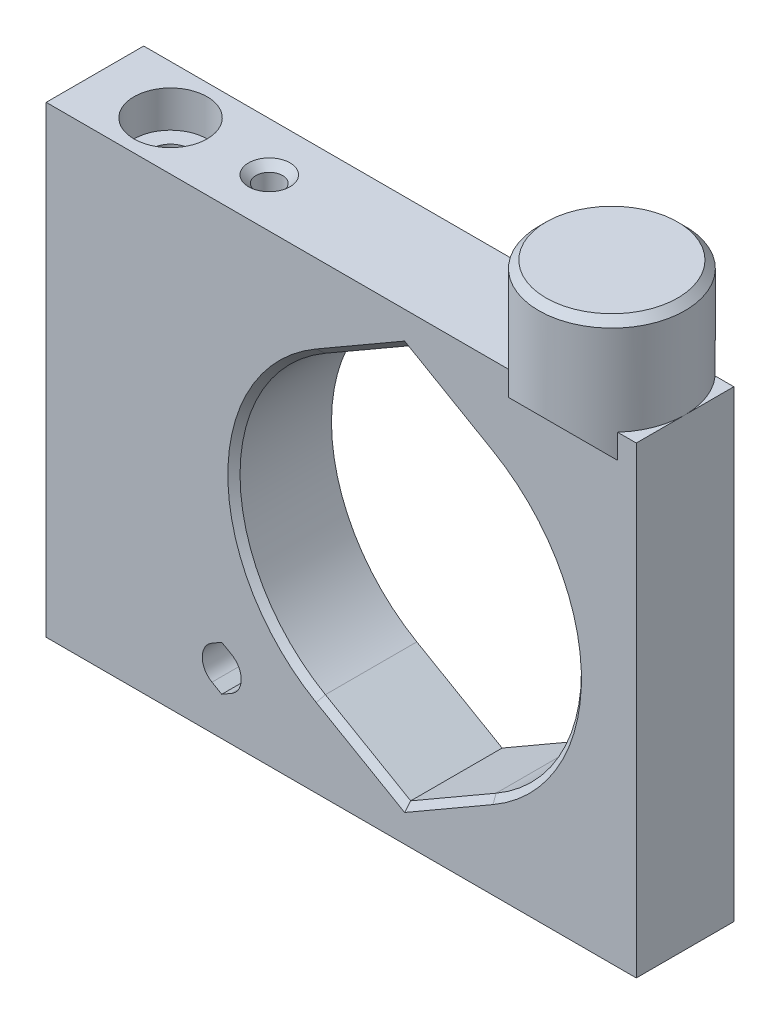
from build123d import *

# Parameters (mm, degrees)
SKETCH1_W           = 48.4
SKETCH1_H           = 38
BOSS_EXTRUDE1_DEPTH = 8
SKETCH2_R           = 3
CUT_EXTRUDE1_DEPTH  = 3
SKETCH3_R           = 1.6
CUT_EXTRUDE2_DEPTH  = 32
CUT_EXTRUDE3_DEPTH  = 3
CUT_EXTRUDE4_DEPTH  = 3
SKETCH6_R           = 1.1
CUT_EXTRUDE5_DEPTH  = 5
CHAMFER1_SIZE       = 0.6
CHAMFER2_SIZE       = 0.5
CHAMFER3_SIZE       = 1.6
SKETCH8_R           = 6
BOSS_EXTRUDE2_DEPTH = 8
CHAMFER4_SIZE       = 2
CHAMFER5_SIZE       = 0.6


with BuildPart() as part:
    # Sketch1 → Boss-Extrude1 (new body)
    with BuildSketch(Plane.XY):
        with Locations((-5.2, 0)):
            Rectangle(SKETCH1_W, SKETCH1_H)
        with BuildLine():
            Line((-7, 12.124355653), (0, 16.165807537))
            Line((0, 16.165807537), (7, 12.124355653))
            ThreePointArc((7, 12.124355653), (14, 0), (7, -12.124355653))
            Line((7, -12.124355653), (0, -16.165807537))
            Line((0, -16.165807537), (-7, -12.124355653))
            ThreePointArc((-7, -12.124355653), (-14, 0), (-7, 12.124355653))
        make_face(mode=Mode.SUBTRACT)
        with BuildLine():
            Line((-15.8, -12.614359354), (-15, -12.152479139))
            Line((-15, -12.152479139), (-14.2, -12.614359354))
            ThreePointArc((-14.2, -12.614359354), (-13.4, -14), (-14.2, -15.385640646))
            Line((-14.2, -15.385640646), (-15, -15.847520861))
            Line((-15, -15.847520861), (-15.8, -15.385640646))
            ThreePointArc((-15.8, -15.385640646), (-16.6, -14), (-15.8, -12.614359354))
        make_face(mode=Mode.SUBTRACT)
    extrude(amount=BOSS_EXTRUDE1_DEPTH)

    # Sketch2 → Cut-Extrude1 (cut)
    with BuildSketch(Plane(origin=(0, 19, 0), x_dir=(1, 0, 0), z_dir=(0, 1, 0))):
        with Locations(Location((-23.2, -4, 0), (0, 0, 270))):
            Circle(SKETCH2_R)
    extrude(amount=-CUT_EXTRUDE1_DEPTH, mode=Mode.SUBTRACT)

    # Sketch3 → Cut-Extrude2 (cut)
    with BuildSketch(Plane(origin=(0, 16, 0), x_dir=(1, 0, 0), z_dir=(0, 1, 0))):
        with Locations(Location((-23.2, -4, 0), (0, 0, 270))):
            Circle(SKETCH3_R)
    extrude(amount=-CUT_EXTRUDE2_DEPTH, mode=Mode.SUBTRACT)

    # Sketch4 → Cut-Extrude3 (cut)
    with BuildSketch(Plane.XZ.offset(19)):
        Polygon((-25.95, 5.58771324), (-25.95, 2.41228676), (-23.2, 0.824573519), (-20.45, 2.41228676), (-20.45, 5.58771324), (-23.2, 7.175426481), align=None)
    extrude(amount=-CUT_EXTRUDE3_DEPTH, mode=Mode.SUBTRACT)

    # Sketch5 → Cut-Extrude4 (cut)
    with BuildSketch(Plane(origin=(0, 0, 0), x_dir=(-1, 0, 0), z_dir=(0, 0, -1))):
        Polygon((12.25, -15.58771324), (12.25, -12.41228676), (15, -10.824573519), (17.75, -12.41228676), (17.75, -15.58771324), (15, -17.175426481), align=None)
    extrude(amount=-CUT_EXTRUDE4_DEPTH, mode=Mode.SUBTRACT)

    # Sketch6 → Cut-Extrude5 (cut)
    with BuildSketch(Plane(origin=(0, 19, 0), x_dir=(1, 0, 0), z_dir=(0, 1, 0))):
        with Locations(Location((-15.1, -4, 0), (0, 0, 270))):
            Circle(SKETCH6_R)
    extrude(amount=-CUT_EXTRUDE5_DEPTH, mode=Mode.SUBTRACT)

    # Chamfer1
    chamfer1_edges = [part.edges().sort_by_distance(p)[0] for p in [
        (-15.1, 19, 2.9),
        (-24.575, -19, 6.38156986),
        (-25.95, -19, 4),
        (-24.575, -19, 1.61843014),
        (-21.825, -19, 1.61843014),
        (-20.45, -19, 4),
        (-21.825, -19, 6.38156986),
    ]]
    chamfer(chamfer1_edges, length=CHAMFER1_SIZE)

    # Chamfer2
    chamfer2_edges = [part.edges().sort_by_distance(p)[0] for p in [
        (-14, 0, 8),
        (-3.5, -14.145081595, 8),
        (3.5, -14.145081595, 8),
        (14, 0, 8),
        (3.5, 14.145081595, 8),
        (-3.5, 14.145081595, 8),
    ]]
    chamfer(chamfer2_edges, length=CHAMFER2_SIZE)

    # Chamfer3
    # the kernel refuses this chamfer: 1.6 mm, written as the material it takes off along each edge
    with BuildSketch(Plane(origin=(-23.2, -16, 4), x_dir=(0, 0, 1), z_dir=(-1, 0, 0))) as chamfer3_piece_1_section:
        Polygon((1.6, CHAMFER3_SIZE), (1.6 + CHAMFER3_SIZE, 0), (1.6, 0), align=None)
    chamfer3_piece_1 = revolve(axis=Axis((-23.2, -16, 4), (0, 1, 0)), mode=Mode.PRIVATE)
    chamfer3_piece_1 = split(chamfer3_piece_1, bisect_by=Plane(origin=(-25.591184435, -15.183394219, 5.794875504), z_dir=(0.5000000000000009, 0, -0.8660254037844382)), keep=Keep.TOP, mode=Mode.PRIVATE)
    chamfer3_piece_1 = split(chamfer3_piece_1, bisect_by=Plane(origin=(-20.808815565, -15.183394219, 5.794875504), z_dir=(-0.4999999999999998, 0, -0.8660254037844388)), keep=Keep.TOP, mode=Mode.PRIVATE)
    chamfer3_piece_1 = split(chamfer3_piece_1, bisect_by=Plane(origin=(-25.95, -15.183394219, 1.653222572), z_dir=(1, 0, 0)), keep=Keep.TOP, mode=Mode.PRIVATE)
    chamfer3_piece_1 = split(chamfer3_piece_1, bisect_by=Plane(origin=(-20.45, -15.183394219, 1.653222572), z_dir=(-1, 0, 0)), keep=Keep.TOP, mode=Mode.PRIVATE)
    chamfer3_piece_1 = split(chamfer3_piece_1, bisect_by=Plane(origin=(-23.558815565, -15.183394219, 1.031735783), z_dir=(0.5000000000000006, 0, 0.8660254037844384)), keep=Keep.TOP, mode=Mode.PRIVATE)
    chamfer3_piece_1 = split(chamfer3_piece_1, bisect_by=Plane(origin=(-22.841184435, -15.183394219, 1.031735783), z_dir=(-0.4999999999999998, 0, 0.8660254037844388)), keep=Keep.TOP, mode=Mode.PRIVATE)
    add(chamfer3_piece_1, mode=Mode.SUBTRACT)

    # Sketch8 → Boss-Extrude2 (add)
    with BuildSketch(Plane(origin=(0, 19, 0), x_dir=(1, 0, 0), z_dir=(0, 1, 0))):
        with Locations(Location((13, -4, 0), (0, 0, 138.189685104))):
            Circle(SKETCH8_R)
    extrude(amount=BOSS_EXTRUDE2_DEPTH)

    # Chamfer4
    # the kernel refuses this chamfer: 2 mm, written as the material it adds along each edge
    with BuildSketch(Plane(origin=(22.615501931, 19, 0), x_dir=(0, -0.9996219169112968, 0.02749587661058639), z_dir=(-1, 0, 0))) as chamfer4_piece_1_section:
        Polygon((CHAMFER4_SIZE * 0.999621916911, -CHAMFER4_SIZE * 0.0274958766106), (-CHAMFER4_SIZE * 0.0274958766106, -CHAMFER4_SIZE * 0.999621916911), (0, 0), align=None)
    chamfer4_piece_1 = extrude(amount=19.231003862, mode=Mode.PRIVATE)
    chamfer4_piece_1 = chamfer4_piece_1 & Plane(origin=(13, 18.289975825, 4), x_dir=(-0.7453559924973536, 0, -0.666666666669547), z_dir=(0, -1, 0)) * Cylinder(6, 47, mode=Mode.PRIVATE)
    add(chamfer4_piece_1)
    with BuildSketch(Plane(origin=(22.615501931, 19, 8), x_dir=(0, -0.9996219169112968, -0.02749587661058651), z_dir=(-1, 0, 0))) as chamfer4_piece_2_section:
        Polygon((CHAMFER4_SIZE * 0.999621916911, CHAMFER4_SIZE * 0.0274958766106), (-CHAMFER4_SIZE * 0.0274958766106, CHAMFER4_SIZE * 0.999621916911), (0, 0), align=None)
    chamfer4_piece_2 = extrude(amount=19.231003862, mode=Mode.PRIVATE)
    chamfer4_piece_2 = chamfer4_piece_2 & Plane(origin=(13, 18.289975825, 4), x_dir=(-0.7453559924973536, 0, -0.666666666669547), z_dir=(0, -1, 0)) * Cylinder(6, 47, mode=Mode.PRIVATE)
    add(chamfer4_piece_2)

    # Chamfer5
    chamfer5_edges = [part.edges().sort_by_distance(p)[0] for p in [
        (17.472135955, 27, 8),
    ]]
    chamfer(chamfer5_edges, length=CHAMFER5_SIZE)


solid = part.part
